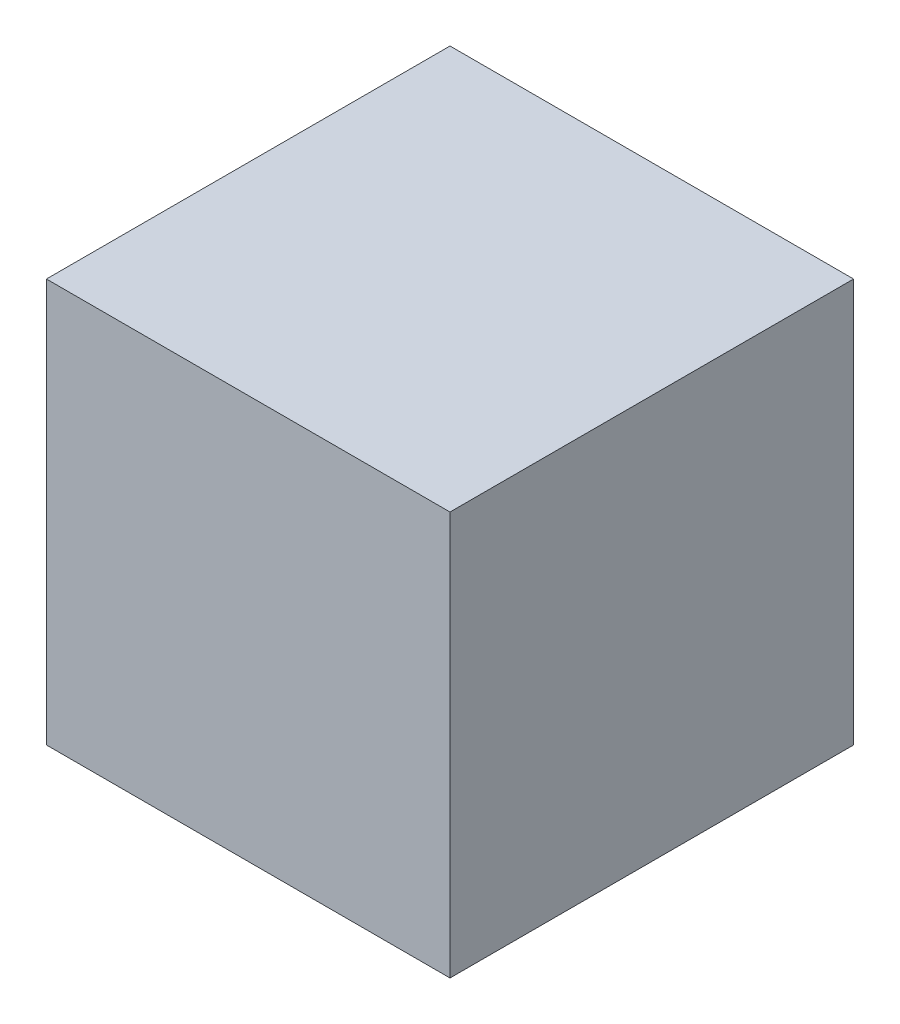
from build123d import *

# Parameters (mm, degrees)
SKETCH1_W           = 3
SKETCH1_H           = 3
BOSS_EXTRUDE1_DEPTH = 1.5


with BuildPart() as part:
    # Sketch1 → Boss-Extrude1 (new, symmetric)
    with BuildSketch(Plane(origin=(0, 0, 0), x_dir=(1, 0, 0), z_dir=(0, 1, 0))):
        Rectangle(SKETCH1_W, SKETCH1_H)
    extrude(amount=BOSS_EXTRUDE1_DEPTH, both=True)


solid = part.part
